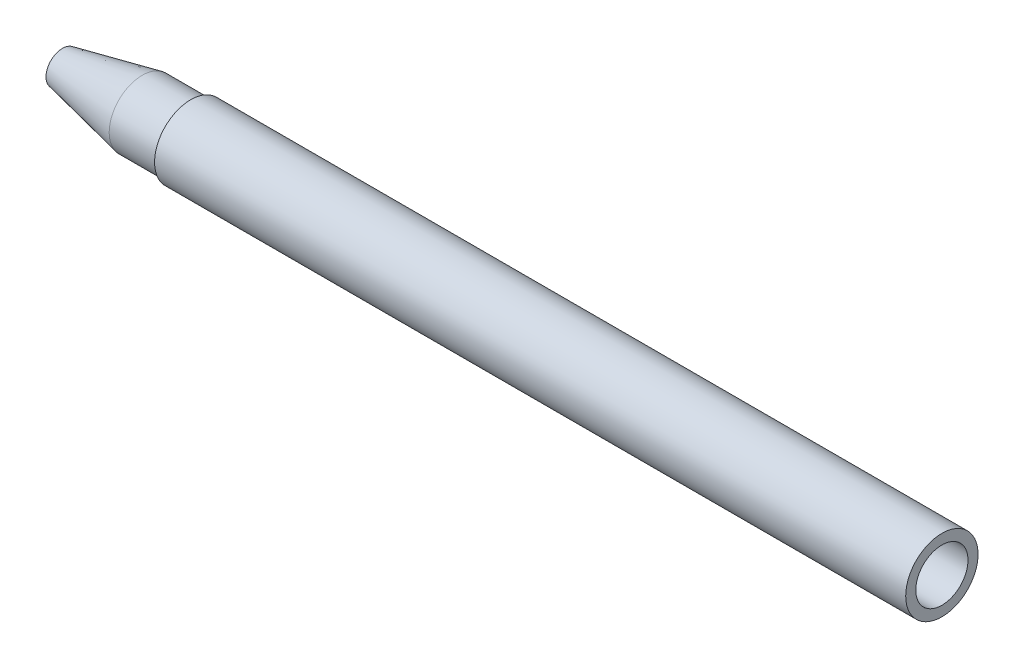
from build123d import *


with BuildPart() as part:
    # Sketch1 → Revolve1 (revolve)
    with BuildSketch(Plane.XY):
        Polygon((-51.9, 0), (51.9, 0), (51.9, -1.39), (-58.6, -1.39), (-69.63, -3.69), (-69.63, -2.73), (-58.6, -0.43), (-51.9, -0.43), align=None)
    revolve(axis=Axis((-81.236098172, -5, 0), (1, 0, 0)))


solid = part.part
